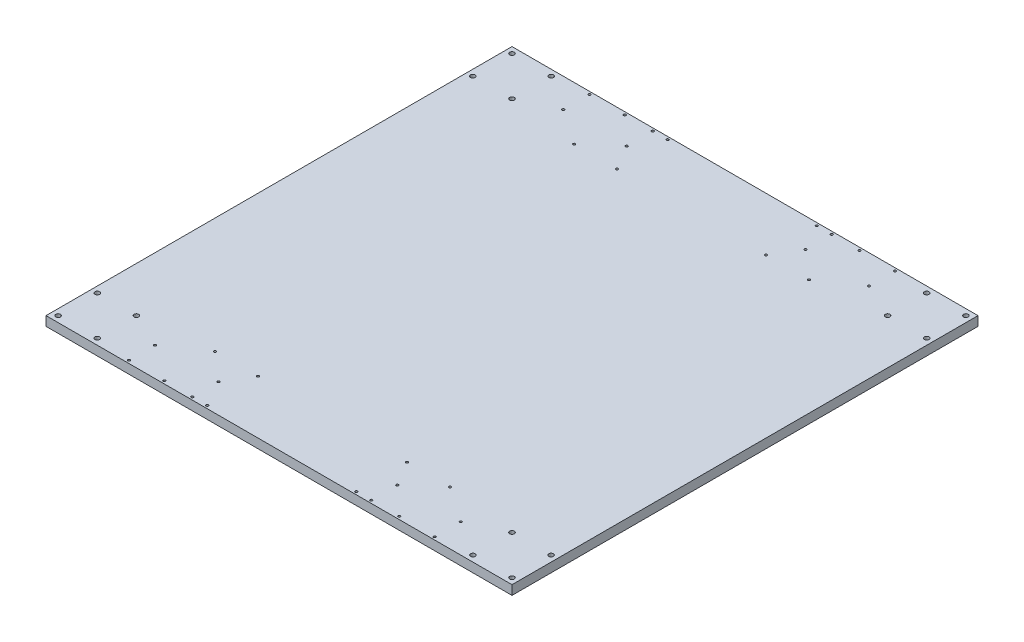
from build123d import *

# Parameters (mm, degrees)
SKETCH1_W                   = 500
SKETCH1_H                   = 500
BOSS_EXTRUDE1_DEPTH         = 10
TAP_DRILL_FOR_M3X0_5_TAP1_D = 2.5
TAP_DRILL_FOR_M6X1_0_TAP1_D = 5
CIRPATTERN1_COUNT           = 4


with BuildPart() as part:
    # Sketch1 → Boss-Extrude1 (new body)
    with BuildSketch(Plane(origin=(0, 0, 0), x_dir=(1, 0, 0), z_dir=(0, 1, 0))):
        Rectangle(SKETCH1_W, SKETCH1_H)
    extrude(amount=BOSS_EXTRUDE1_DEPTH)

    # Tap Drill for M3x0.5 Tap1 (through all)
    with Locations(Plane(origin=(0, 10, 0), x_dir=(1, 0, 0), z_dir=(0, 1, 0))):
        with Locations((164, -219), (164, -247), (96, -247), (96, -219), (-96, -219), (-164, -219), (-164, -247), (-96, -247), (-96, 219), (-96, 247), (-164, 247), (-164, 219), (96, 247), (164, 247), (164, 219), (96, 219), (-126, 247), (-80, 247), (-80, 192.6), (-126, 192.6), (80, 247), (126, 247), (126, 192.6), (80, 192.6), (80, -192.6), (126, -192.6), (126, -247), (80, -247), (-126, -192.6), (-80, -192.6), (-80, -247), (-126, -247)):
            Hole(TAP_DRILL_FOR_M3X0_5_TAP1_D / 2)

    # Tap Drill for M6x1.0 Tap1 (through all)
    with Locations(Plane(origin=(0, 10, 0), x_dir=(1, 0, 0), z_dir=(0, 1, 0))):
        with Locations((243.5, -243.5), (201.5, -201.5), (243.5, -201.5), (201.5, -243.5)):
            tap_drill_for_m6x1_0_tap1 = Hole(TAP_DRILL_FOR_M6X1_0_TAP1_D / 2)

    # CirPattern1: Tap Drill for M6x1.0 Tap1 ×4 about axis
    cirpattern1_axis = Axis((0, 10.5, 0), (0, -1, 0))
    for i in range(1, CIRPATTERN1_COUNT):
        add(tap_drill_for_m6x1_0_tap1.rotate(cirpattern1_axis, i * 360 / CIRPATTERN1_COUNT), mode=Mode.SUBTRACT)


solid = part.part
